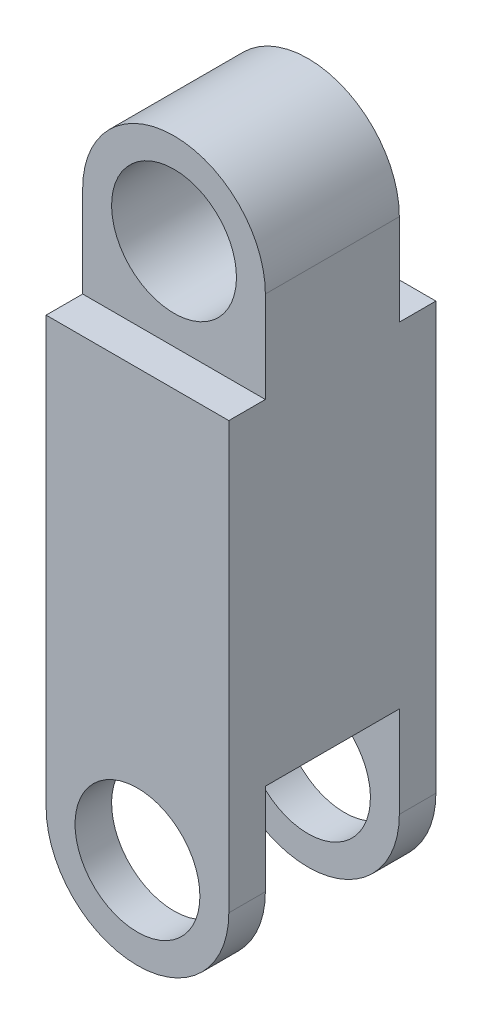
from build123d import *

# Parameters (mm, degrees)
SKETCH1_R               = 10.25
BOSS_EXTRUDE2_DEPTH     = 34
CUT_EXTRUDE3_DEPTH      = 110.79981785
CUT_EXTRUDE3_DEPTH_BACK = 110.79981785
SKETCH3_W               = 6
SKETCH3_H               = 30
SKETCH3_W_2             = 22


with BuildPart() as part:
    # Sketch1 → Boss-Extrude2 (new body)
    with BuildSketch(Plane.XY):
        with BuildLine():
            Line((15, -85), (15, 0))
            ThreePointArc((15, 0), (0, 15), (-15, 0))
            Line((-15, 0), (-15, -85))
            ThreePointArc((-15, -85), (0, -100), (15, -85))
        make_face()
        with Locations((0, -85)):
            Circle(SKETCH1_R, mode=Mode.SUBTRACT)
        Circle(SKETCH1_R, mode=Mode.SUBTRACT)
    extrude(amount=BOSS_EXTRUDE2_DEPTH)

    # Sketch3 → Cut-Extrude3 (cut, two sides: drawn at the far end of the back side and taken through both)
    with BuildSketch(Plane.ZY.offset(15).offset(-CUT_EXTRUDE3_DEPTH_BACK)):
        with Locations((3, 0)):
            Rectangle(SKETCH3_W, SKETCH3_H)
        with Locations((31, 0)):
            Rectangle(SKETCH3_W, SKETCH3_H)
        with Locations((17, -85)):
            Rectangle(SKETCH3_W_2, SKETCH3_H)
    extrude(amount=CUT_EXTRUDE3_DEPTH + CUT_EXTRUDE3_DEPTH_BACK, mode=Mode.SUBTRACT)


solid = part.part
